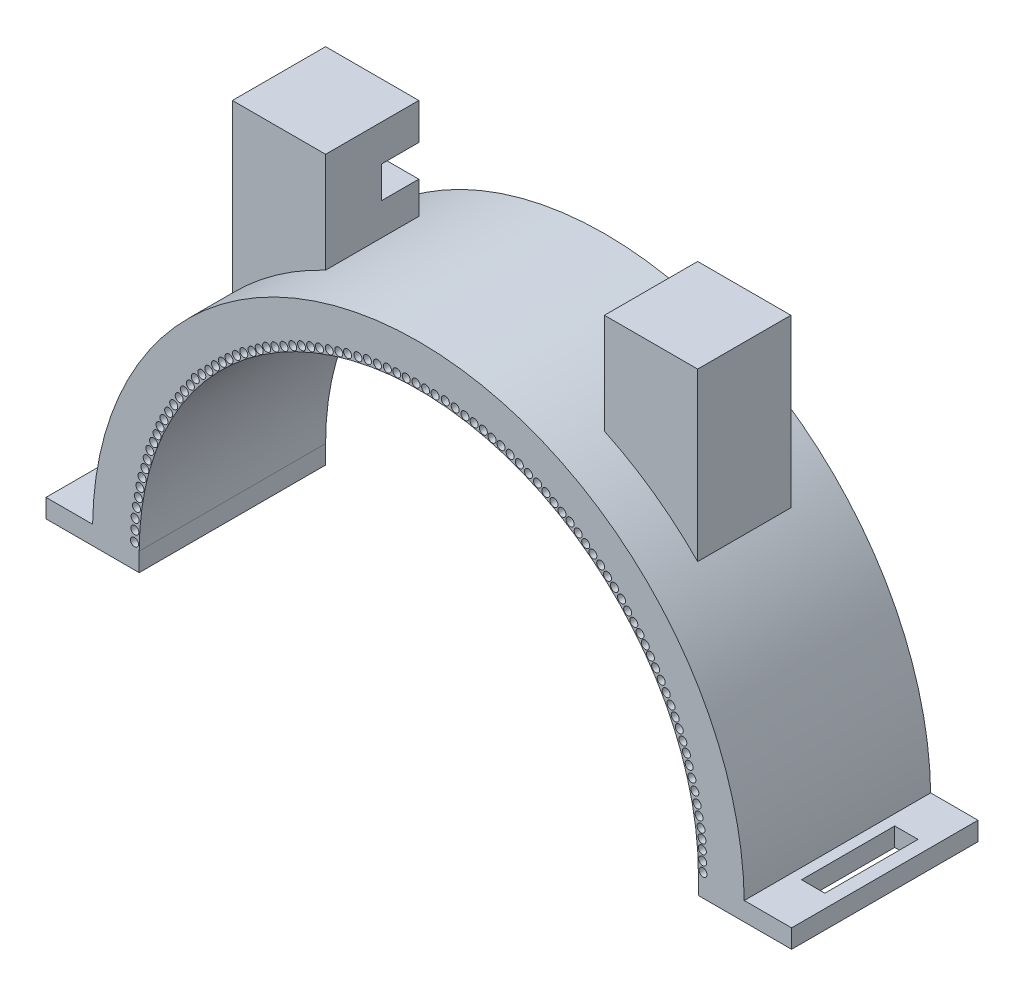
from build123d import *

# Parameters (mm, degrees)
BOSS_EXTRUDE1_DEPTH             = 20
SKETCH2_W                       = 10
SKETCH2_H                       = 2
BOSS_EXTRUDE2_DEPTH             = 20
SKETCH3_W                       = 2.5
SKETCH3_H                       = 10
CUT_EXTRUDE1_DEPTH              = 64.695758612
BOSS_EXTRUDE3_REACH             = 95.867
BOSS_EXTRUDE3_START             = 29
SKETCH5_W                       = 10
SKETCH5_H                       = 10
BOSS_EXTRUDE3_DIRECTION_2_DEPTH = 15
SKETCH15_W                      = 9.957494595
SKETCH15_H                      = 3.486023066
SKETCH15_W_2                    = 10
SKETCH15_H_2                    = 3.406795269
CUT_EXTRUDE2_DEPTH              = 4
SKETCH16_R                      = 0.429985908
CUT_EXTRUDE3_DEPTH              = 70.31700842
SKETCH19_R                      = 0.43
CUT_EXTRUDE4_DEPTH              = 70.31700842


with BuildPart() as part:
    # Sketch1 → Boss-Extrude1 (new body)
    with BuildSketch(Plane.XY):
        with BuildLine():
            Line((-44.6875, 2.119473798), (-39.6875, 2.119473798))
            ThreePointArc((-39.6875, 2.119473798), (-9.6875, 32.119473798), (20.3125, 2.119473798))
            Line((20.3125, 2.119473798), (25.232533649, 2.119473798))
            ThreePointArc((25.232533649, 2.119473798), (-9.727483176, 36.591230483), (-44.6875, 2.119473798))
        make_face()
    extrude(amount=BOSS_EXTRUDE1_DEPTH)

    # Sketch2 → Boss-Extrude2 (add)
    with BuildSketch(Plane.XY.offset(20)):
        with Locations((25.3125, 1.119473798)):
            Rectangle(SKETCH2_W, SKETCH2_H)
        with Locations((-44.6875, 1.119473798)):
            Rectangle(SKETCH2_W, SKETCH2_H)
    extrude(amount=-BOSS_EXTRUDE2_DEPTH)

    # Sketch3 → Cut-Extrude1 (cut, through all)
    with BuildSketch(Plane(origin=(0, 2.119473798, 0), x_dir=(1, 0, 0), z_dir=(0, 1, 0))):
        with Locations((-47.1875, -10)):
            Rectangle(SKETCH3_W, SKETCH3_H)
        with Locations((27.628360341, -10)):
            Rectangle(SKETCH3_W, SKETCH3_H)
    extrude(amount=-CUT_EXTRUDE1_DEPTH, mode=Mode.SUBTRACT)

    # Sketch5 → Boss-Extrude3 (add, up to next)
    with BuildSketch(Plane(origin=(0, 0, 0), x_dir=(1, 0, 0), z_dir=(0, 1, 0)).offset(BOSS_EXTRUDE3_START), mode=Mode.PRIVATE) as boss_extrude3_sk1:
        with Locations((-29.6875, -10)):
            Rectangle(SKETCH5_W, SKETCH5_H)
    boss_extrude3_tool1 = extrude(boss_extrude3_sk1.sketch, amount=-BOSS_EXTRUDE3_REACH, mode=Mode.PRIVATE) - part.part
    # Sketch5 → Boss-Extrude3 (add, up to next)
    with BuildSketch(Plane(origin=(0, 0, 0), x_dir=(1, 0, 0), z_dir=(0, 1, 0)).offset(BOSS_EXTRUDE3_START), mode=Mode.PRIVATE) as boss_extrude3_sk2:
        with Locations((10.232533649, -10)):
            Rectangle(SKETCH5_W, SKETCH5_H)
    boss_extrude3_tool2 = extrude(boss_extrude3_sk2.sketch, amount=-BOSS_EXTRUDE3_REACH, mode=Mode.PRIVATE) - part.part
    add(boss_extrude3_tool1.solids().sort_by_distance((-29.6875, 29, 10))[0])
    add(boss_extrude3_tool2.solids().sort_by_distance((10.232534, 29, 10))[0])

    # Sketch5 → Boss-Extrude3 direction 2 (add)
    with BuildSketch(Plane(origin=(0, 0, 0), x_dir=(1, 0, 0), z_dir=(0, 1, 0)).offset(BOSS_EXTRUDE3_START)):
        with Locations((-29.6875, -10)):
            Rectangle(SKETCH5_W, SKETCH5_H)
        with Locations((10.232533649, -10)):
            Rectangle(SKETCH5_W, SKETCH5_H)
    extrude(amount=BOSS_EXTRUDE3_DIRECTION_2_DEPTH)

    # Sketch15 → Cut-Extrude2 (cut)
    with BuildSketch(Plane(origin=(0, 0, 5), x_dir=(-1, 0, 0), z_dir=(0, 0, -1))):
        with Locations((-10.211280947, 38.350092999)):
            Rectangle(SKETCH15_W, SKETCH15_H)
        with Locations((29.6875, 38.389706898)):
            Rectangle(SKETCH15_W_2, SKETCH15_H_2)
    extrude(amount=-CUT_EXTRUDE2_DEPTH, mode=Mode.SUBTRACT)

    # Sketch16 → Cut-Extrude3 (cut, through all)
    with BuildSketch(Plane.XY):
        with Locations((-40.194076416, 2.70790241)):
            Circle(SKETCH16_R)
    extrude(amount=CUT_EXTRUDE3_DEPTH, mode=Mode.SUBTRACT)

    # Sketch19 → Cut-Extrude4 (cut, through all)
    with BuildSketch(Plane(origin=(0, 0, 0), x_dir=(-1, 0, 0), z_dir=(0, 0, -1))):
        with Locations((40.157773316, 3.842579994)):
            Circle(SKETCH19_R)
        with Locations((40.129976485, 4.951475276)):
            Circle(SKETCH19_R)
        with Locations((39.976743657, 6.041690441)):
            Circle(SKETCH19_R)
        with Locations((39.77957363, 7.060618267)):
            Circle(SKETCH19_R)
        with Locations((39.611616001, 8.083648579)):
            Circle(SKETCH19_R)
        with Locations((39.384056604, 9.117159584)):
            Circle(SKETCH19_R)
        with Locations((38.829794547, 11.043164756)):
            Circle(SKETCH19_R)
        with Locations((38.552022228, 12.048984433)):
            Circle(SKETCH19_R)
        with Locations((39.088806217, 10.095021994)):
            Circle(SKETCH19_R)
        with Locations((38.141177141, 12.983497136)):
            Circle(SKETCH19_R)
        with Locations((37.768769018, 13.895051344)):
            Circle(SKETCH19_R)
        with Locations((37.448916338, 14.800008888)):
            Circle(SKETCH19_R)
        with Locations((37.032221222, 15.670387014)):
            Circle(SKETCH19_R)
        with Locations((36.528360395, 16.609796608)):
            Circle(SKETCH19_R)
        with Locations((35.986242339, 17.577737268)):
            Circle(SKETCH19_R)
        with Locations((35.393593155, 18.525538356)):
            Circle(SKETCH19_R)
        with Locations((34.843911912, 19.412863745)):
            Circle(SKETCH19_R)
        with Locations((34.19539752, 20.296560878)):
            Circle(SKETCH19_R)
        with Locations((33.671579827, 21.16369959)):
            Circle(SKETCH19_R)
        with Locations((30.049939441, 24.82228941)):
            Circle(SKETCH19_R)
        with Locations((29.247761657, 25.528887704)):
            Circle(SKETCH19_R)
        with Locations((28.468285707, 26.171032429)):
            Circle(SKETCH19_R)
        with Locations((27.575265581, 26.752789683)):
            Circle(SKETCH19_R)
        with Locations((26.807973066, 27.321370243)):
            Circle(SKETCH19_R)
        with Locations((26.018155923, 27.899111723)):
            Circle(SKETCH19_R)
        with Locations((25.117140803, 28.388278306)):
            Circle(SKETCH19_R)
        with Locations((24.152740884, 28.916859444)):
            Circle(SKETCH19_R)
        with Locations((23.213415748, 29.452693957)):
            Circle(SKETCH19_R)
        with Locations((22.265953613, 29.915077196)):
            Circle(SKETCH19_R)
        with Locations((21.292090137, 30.317791635)):
            Circle(SKETCH19_R)
        with Locations((20.341195492, 30.670660652)):
            Circle(SKETCH19_R)
        with Locations((19.294443445, 31.027159999)):
            Circle(SKETCH19_R)
        with Locations((18.273341346, 31.346527811)):
            Circle(SKETCH19_R)
        with Locations((17.330694676, 31.659064493)):
            Circle(SKETCH19_R)
        with Locations((16.213760043, 31.925126509)):
            Circle(SKETCH19_R)
        with Locations((15.196392743, 32.163250345)):
            Circle(SKETCH19_R)
        with Locations((14.118871826, 32.276097443)):
            Circle(SKETCH19_R)
        with Locations((9.989341485, 32.586591657)):
            Circle(SKETCH19_R)
        with Locations((32.972067882, 21.91183374)):
            Circle(SKETCH19_R)
        with Locations((32.214660672, 22.653461633)):
            Circle(SKETCH19_R)
        with Locations((31.504591412, 23.442427477)):
            Circle(SKETCH19_R)
        with Locations((30.768790829, 24.13924253)):
            Circle(SKETCH19_R)
        with Locations((13.058680454, 32.446158075)):
            Circle(SKETCH19_R)
        with Locations((12.053860203, 32.501632039)):
            Circle(SKETCH19_R)
        with Locations((11.034344787, 32.535615887)):
            Circle(SKETCH19_R)
        with Locations((8.961330107, 32.55260781)):
            Circle(SKETCH19_R)
        with Locations((7.941814691, 32.518623963)):
            Circle(SKETCH19_R)
        with Locations((6.837339657, 32.518623963)):
            Circle(SKETCH19_R)
        with Locations((5.780100612, 32.378387633)):
            Circle(SKETCH19_R)
        with Locations((4.731513778, 32.180229491)):
            Circle(SKETCH19_R)
        with Locations((3.748979658, 32.015097706)):
            Circle(SKETCH19_R)
        with Locations((2.758188948, 31.825196153)):
            Circle(SKETCH19_R)
        with Locations((1.825194364, 31.544472119)):
            Circle(SKETCH19_R)
        with Locations((0.859173422, 31.338057388)):
            Circle(SKETCH19_R)
        with Locations((-0.115104109, 31.016050407)):
            Circle(SKETCH19_R)
        with Locations((-1.097638229, 30.636247302)):
            Circle(SKETCH19_R)
        with Locations((-2.076149977, 30.222346847)):
            Circle(SKETCH19_R)
        with Locations((-3.049992433, 29.818110356)):
            Circle(SKETCH19_R)
        with Locations((-3.950337346, 29.386312285)):
            Circle(SKETCH19_R)
        with Locations((-4.813933487, 28.890203864)):
            Circle(SKETCH19_R)
        with Locations((-5.677529628, 28.412469829)):
            Circle(SKETCH19_R)
        with Locations((-6.550312962, 27.962297372)):
            Circle(SKETCH19_R)
        with Locations((-7.413502609, 27.366093596)):
            Circle(SKETCH19_R)
        with Locations((-8.219973711, 26.777503937)):
            Circle(SKETCH19_R)
        with Locations((-8.986938394, 26.196288512)):
            Circle(SKETCH19_R)
        with Locations((-9.831797929, 25.597097353)):
            Circle(SKETCH19_R)
        with Locations((-10.553062854, 24.903287734)):
            Circle(SKETCH19_R)
        with Locations((-11.310165464, 24.258114165)):
            Circle(SKETCH19_R)
        with Locations((-12.06420723, 23.557388483)):
            Circle(SKETCH19_R)
        with Locations((-12.726849995, 22.772880383)):
            Circle(SKETCH19_R)
        with Locations((-13.381876175, 22.041688367)):
            Circle(SKETCH19_R)
        with Locations((-14.045284633, 21.325390255)):
            Circle(SKETCH19_R)
        with Locations((-14.610568668, 20.575076455)):
            Circle(SKETCH19_R)
        with Locations((-15.160955996, 19.793949768)):
            Circle(SKETCH19_R)
        with Locations((-15.722428913, 18.979418635)):
            Circle(SKETCH19_R)
        with Locations((-16.323442177, 18.141163294)):
            Circle(SKETCH19_R)
        with Locations((-16.861190886, 17.247551468)):
            Circle(SKETCH19_R)
        with Locations((-17.370099884, 16.349117506)):
            Circle(SKETCH19_R)
        with Locations((-17.822461681, 15.472834796)):
            Circle(SKETCH19_R)
        with Locations((-18.259251056, 14.590047971)):
            Circle(SKETCH19_R)
        with Locations((-18.641379366, 13.645130385)):
            Circle(SKETCH19_R)
        with Locations((-19.030723208, 12.71256922)):
            Circle(SKETCH19_R)
        with Locations((-19.316434923, 11.726402977)):
            Circle(SKETCH19_R)
        with Locations((-19.611363146, 10.684937692)):
            Circle(SKETCH19_R)
        with Locations((-19.926919345, 9.635249333)):
            Circle(SKETCH19_R)
        with Locations((-20.1750725, 8.564272558)):
            Circle(SKETCH19_R)
        with Locations((-20.384043578, 7.545538552)):
            Circle(SKETCH19_R)
        with Locations((-20.593014656, 6.526804546)):
            Circle(SKETCH19_R)
        with Locations((-20.697500195, 5.573374003)):
            Circle(SKETCH19_R)
        with Locations((-20.736682272, 4.580761382)):
            Circle(SKETCH19_R)
        with Locations((-20.767815184, 3.558359305)):
            Circle(SKETCH19_R)
        with Locations((-20.808866838, 2.521805048)):
            Circle(SKETCH19_R)
    extrude(amount=-CUT_EXTRUDE4_DEPTH, mode=Mode.SUBTRACT)


solid = part.part
